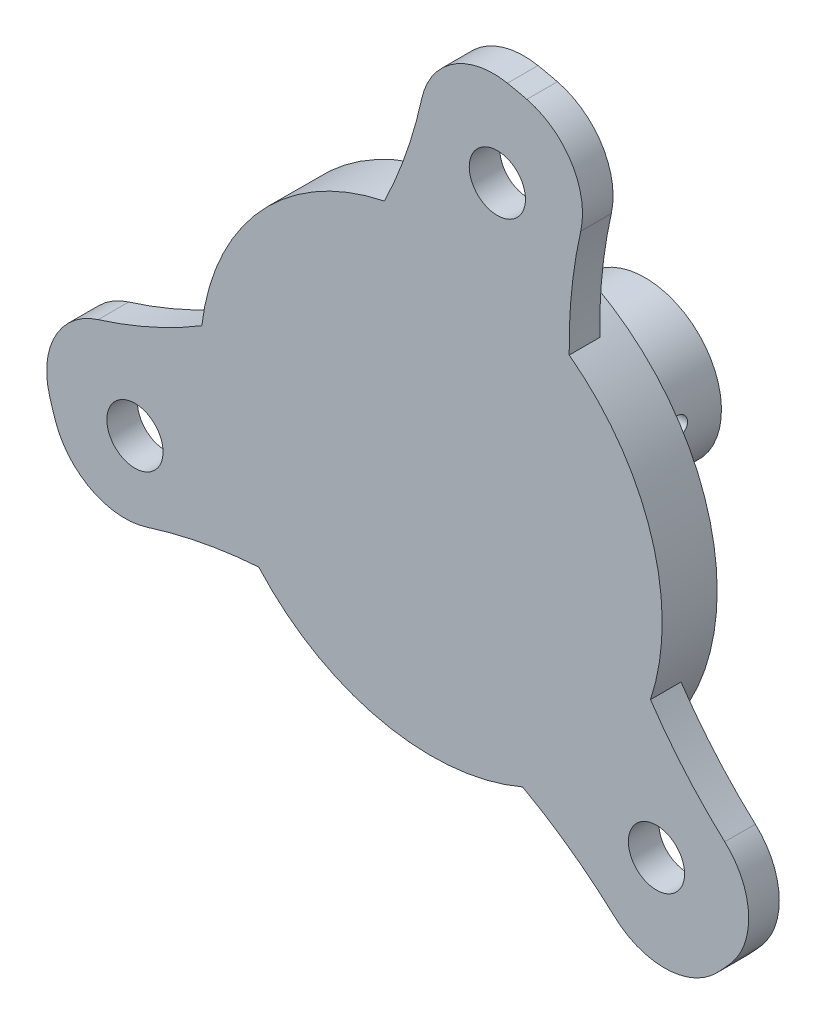
from build123d import *

# Parameters (mm, degrees)
SKETCH1_R                           = 65
BOSS_EXTRUDE1_DEPTH                 = 5
CUT_EXTRUDE2_START                  = -25
CUT_EXTRUDE2_DEPTH                  = 25
FILLET2_R                           = 12
SKETCH9_R                           = 12.5
BOSS_EXTRUDE4_DEPTH                 = 30
SKETCH10_R                          = 4.95
CUT_EXTRUDE3_DEPTH                  = 97.34882957
SKETCH11_W                          = 5
SKETCH11_H                          = 5
CUT_EXTRUDE4_DEPTH                  = 97.34882957
F_1_0MM_DOWEL_HOLE3_D               = 2.8
F_1_0MM_DOWEL_HOLE3_DEPTH           = 33.158795133
F_1_0MM_DOWEL_HOLE3_TIP             = 0.841204867
F_1_0MM_DOWEL_HOLE3_ON_FACE_2_D     = 2.8
F_1_0MM_DOWEL_HOLE3_ON_FACE_2_DEPTH = 33.158795133
F_1_0MM_DOWEL_HOLE3_ON_FACE_2_TIP   = 0.841204867
BOSS_EXTRUDE5_DEPTH                 = 4
BOSS_EXTRUDE5_DEPTH_BACK            = 5
SKETCH13_R                          = 37.8
F_1_0MM_DOWEL_HOLE4_D               = 9.2
F_1_0MM_DOWEL_HOLE4_DEPTH           = 31.236041152
F_1_0MM_DOWEL_HOLE4_TIP             = 2.763958848
FILLET4_R                           = 15


with BuildPart() as part:
    # Sketch1 → Boss-Extrude1 (new body)
    with BuildSketch(Plane.XY):
        Circle(SKETCH1_R)
    extrude(amount=BOSS_EXTRUDE1_DEPTH)

    # Sketch6 → Cut-Extrude2 (cut)
    with BuildSketch(Plane.XY.offset(5).offset(CUT_EXTRUDE2_START)):
        with BuildLine():
            ThreePointArc((0, 65), (-47.923026893, 43.913363495), (-64.752655376, -5.665123279))
            ThreePointArc((-64.752655376, -5.665123279), (-20.242011997, 18.548386617), (0, 65))
        make_face()
        with BuildLine():
            ThreePointArc((37.282468363, -53.244882879), (-5.942368011, -26.804289921), (-56.291651246, -32.5))
            ThreePointArc((-56.291651246, -32.5), (-14.068574906, -63.459240463), (37.282468363, -53.244882879))
        make_face()
        with BuildLine():
            ThreePointArc((56.291651246, -32.5), (61.991601799, 19.545876968), (27.470187013, 58.910006157))
            ThreePointArc((27.470187013, 58.910006157), (26.184380008, 8.255903304), (56.291651246, -32.5))
        make_face()
    extrude(amount=CUT_EXTRUDE2_DEPTH, mode=Mode.SUBTRACT)

    # Fillet2
    fillet2_edges = [part.edges().sort_by_distance(p)[0] for p in [
        (27.470187013, 58.910006157, 2.5),
        (56.291651246, -32.5, 2.5),
        (-64.752655376, -5.665123279, 2.5),
        (0, 65, 2.5),
        (37.282468363, -53.244882879, 2.5),
        (-56.291651246, -32.5, 2.5),
    ]]
    fillet(fillet2_edges, radius=FILLET2_R)

    # Sketch9 → Boss-Extrude4 (add)
    with BuildSketch(Plane(origin=(0, 0, 0), x_dir=(-1, 0, 0), z_dir=(0, 0, -1))):
        with Locations(Location((0, 0, 0), (0, 0, 180))):
            Circle(SKETCH9_R)
    extrude(amount=BOSS_EXTRUDE4_DEPTH)

    # Sketch10 → Cut-Extrude3 (cut, through all)
    with BuildSketch(Plane(origin=(0, 0, -30), x_dir=(-1, 0, 0), z_dir=(0, 0, -1))):
        Circle(SKETCH10_R)
    extrude(amount=-CUT_EXTRUDE3_DEPTH, mode=Mode.SUBTRACT)

    # Sketch11 → Cut-Extrude4 (cut, through all)
    with BuildSketch(Plane(origin=(0, 0, -30), x_dir=(-1, 0, 0), z_dir=(0, 0, -1))):
        with Locations((0, 4.95)):
            Rectangle(SKETCH11_W, SKETCH11_H)
    extrude(amount=-CUT_EXTRUDE4_DEPTH, mode=Mode.SUBTRACT)

    # Ø1.0mm Dowel Hole3
    with Locations(Plane(origin=(0, -12.5, -18.578187756), x_dir=(-1, 0, 0), z_dir=(0, -1, 0))):
        with Locations((0, 0)):
            Hole(F_1_0MM_DOWEL_HOLE3_D / 2, depth=F_1_0MM_DOWEL_HOLE3_DEPTH)
            with Locations((0, 0, -(F_1_0MM_DOWEL_HOLE3_DEPTH + F_1_0MM_DOWEL_HOLE3_TIP / 2))):  # 118° drill point
                Cone(0, F_1_0MM_DOWEL_HOLE3_D / 2, F_1_0MM_DOWEL_HOLE3_TIP, mode=Mode.SUBTRACT)

    # Ø1.0mm Dowel Hole3 on face 2
    with Locations(Plane(origin=(12.447431605, 1.14518402, -23.093887112), x_dir=(-0.091614954639, 0.995794506957, 0), z_dir=(0.995794506957, 0.091614954639, 0))):
        with Locations((0, 0)):
            Hole(F_1_0MM_DOWEL_HOLE3_ON_FACE_2_D / 2, depth=F_1_0MM_DOWEL_HOLE3_ON_FACE_2_DEPTH)
            with Locations((0, 0, -(F_1_0MM_DOWEL_HOLE3_ON_FACE_2_DEPTH + F_1_0MM_DOWEL_HOLE3_ON_FACE_2_TIP / 2))):  # 118° drill point
                Cone(0, F_1_0MM_DOWEL_HOLE3_ON_FACE_2_D / 2, F_1_0MM_DOWEL_HOLE3_ON_FACE_2_TIP, mode=Mode.SUBTRACT)

    # Sketch13 → Boss-Extrude5 (add, two sides: drawn at the far end of the back side and taken through both)
    with BuildSketch(Plane(origin=(0, 0, 0), x_dir=(-1, 0, 0), z_dir=(0, 0, -1)).offset(-BOSS_EXTRUDE5_DEPTH_BACK)):
        Circle(SKETCH13_R)
    extrude(amount=BOSS_EXTRUDE5_DEPTH + BOSS_EXTRUDE5_DEPTH_BACK)

    # Ø1.0mm Dowel Hole4
    with Locations(Plane(origin=(10.821980697, 48.814800356, 0), x_dir=(-1, 0, 0), z_dir=(0, 0, -1))):
        with Locations((0, 0), (59.310094228, -65.476990486), (-26.041886144, -82.594310737)):
            Hole(F_1_0MM_DOWEL_HOLE4_D / 2, depth=F_1_0MM_DOWEL_HOLE4_DEPTH)
            with Locations((0, 0, -(F_1_0MM_DOWEL_HOLE4_DEPTH + F_1_0MM_DOWEL_HOLE4_TIP / 2))):  # 118° drill point
                Cone(0, F_1_0MM_DOWEL_HOLE4_D / 2, F_1_0MM_DOWEL_HOLE4_TIP, mode=Mode.SUBTRACT)

    # Fillet4
    # the kernel refuses this fillet: 15 mm, written as the material it adds along each edge
    with BuildSketch(Plane(origin=(0, 0, -4), x_dir=(1, 0, 0), z_dir=(0, -1, 0))) as fillet4_piece_1_section:
        with BuildLine():
            CenterArc((12.5 + FILLET4_R, -FILLET4_R), FILLET4_R, 90, 90)
            Line((12.5, -FILLET4_R), (12.5, 0))
            Line((12.5, 0), (12.5 + FILLET4_R, 0))
        make_face()
    fillet4_piece_1 = revolve(axis=Axis((0, 0, -4), (0, 0, 1)), mode=Mode.PRIVATE)
    fillet4_piece_1 = fillet4_piece_1 - Plane(origin=(0, 0, -18.578187756), x_dir=(1, 0, 0), z_dir=(0, 1, 0)) * Cylinder(1.4, 110, mode=Mode.PRIVATE)
    add(fillet4_piece_1)


solid = part.part
